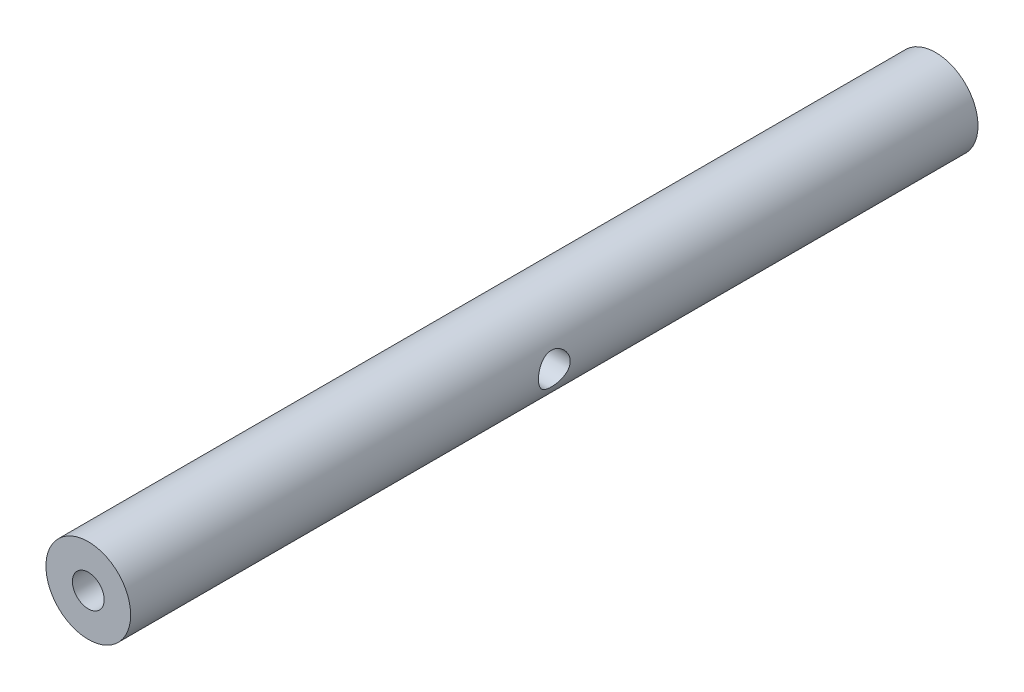
from build123d import *

# Parameters (mm, degrees)
ESBO_O1_R                         = 4
ESBO_O1_R_2                       = 1.5
RESSALTO_EXTRUS_O2_DEPTH          = 80
CORTE_EXTRUS_O1_REACH             = 82.2
ESBO_O2_R                         = 1.5
CORTE_EXTRUS_O1_DIRECTION_2_REACH = 82.2


with BuildPart() as part:
    # Esboço1 → Ressalto-extrusão2 (new body)
    with BuildSketch(Plane.XY):
        Circle(ESBO_O1_R)
        Circle(ESBO_O1_R_2, mode=Mode.SUBTRACT)
    extrude(amount=RESSALTO_EXTRUS_O2_DEPTH)

    # Esboço2 → Corte-extrusão1 (cut, up to next)
    with BuildSketch(Plane(origin=(0, 0, 0), x_dir=(0, 0, -1), z_dir=(1, 0, 0)), mode=Mode.PRIVATE) as corte_extrus_o1_sk1:
        with Locations((-40, 0)):
            Circle(ESBO_O2_R)
    corte_extrus_o1_tool1 = extrude(corte_extrus_o1_sk1.sketch, amount=-CORTE_EXTRUS_O1_REACH, mode=Mode.PRIVATE) & part.part
    add(corte_extrus_o1_tool1.solids().sort_by_distance((0, 0, 40))[0], mode=Mode.SUBTRACT)

    # Esboço2 → Corte-extrusão1 direction 2 (cut, up to next)
    with BuildSketch(Plane(origin=(0, 0, 0), x_dir=(0, 0, -1), z_dir=(1, 0, 0)), mode=Mode.PRIVATE) as corte_extrus_o1_direction_2_sk1:
        with Locations((-40, 0)):
            Circle(ESBO_O2_R)
    corte_extrus_o1_direction_2_tool1 = extrude(corte_extrus_o1_direction_2_sk1.sketch, amount=CORTE_EXTRUS_O1_DIRECTION_2_REACH, mode=Mode.PRIVATE) & part.part
    add(corte_extrus_o1_direction_2_tool1.solids().sort_by_distance((0, 0, 40))[0], mode=Mode.SUBTRACT)


solid = part.part
